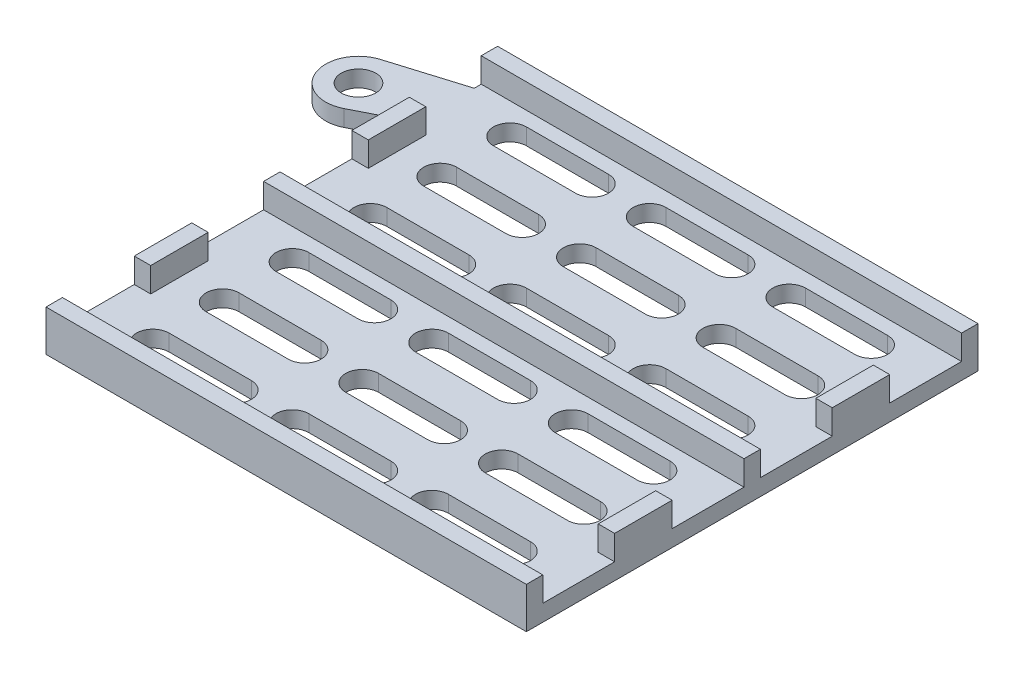
from build123d import *

# Parameters (mm, degrees)
SKETCH1_W           = 54.5
SKETCH1_H           = 24.5
BOSS_EXTRUDE1_DEPTH = 2
BOSS_EXTRUDE2_START = -2
SKETCH2_W           = 58.5
SKETCH2_H           = 28.5
SKETCH2_W_2         = 54.5
SKETCH2_H_2         = 24.5
BOSS_EXTRUDE2_DEPTH = 5
CUT_EXTRUDE1_DEPTH  = 33.918459867
FILL_PATTERN1_DEPTH = 2
LPATTERN1_COUNT     = 2
LPATTERN1_PITCH     = 8.5
LPATTERN1_COL_COUNT = 2
LPATTERN1_COL_PITCH = 8.5
SKETCH13_W          = 8.75
SKETCH13_H          = 3
CUT_EXTRUDE2_DEPTH  = 61.417816081
SKETCH34_R          = 2.1
BOSS_EXTRUDE4_DEPTH = 2


# Read off the part's stored shape, not the designer's step: Fill Pattern1
with BuildPart() as part:
    # Sketch1 → Boss-Extrude1 (new body)
    with BuildSketch(Plane(origin=(0, 0, 0), x_dir=(1, 0, 0), z_dir=(0, 1, 0))):
        Rectangle(SKETCH1_W, SKETCH1_H)
    extrude(amount=BOSS_EXTRUDE1_DEPTH)

    # Sketch2 → Boss-Extrude2 (add)
    with BuildSketch(Plane(origin=(0, 2, 0), x_dir=(1, 0, 0), z_dir=(0, 1, 0)).offset(BOSS_EXTRUDE2_START)):
        Rectangle(SKETCH2_W, SKETCH2_H)
        Rectangle(SKETCH2_W_2, SKETCH2_H_2, mode=Mode.SUBTRACT)
    extrude(amount=BOSS_EXTRUDE2_DEPTH)

    # Sketch5 → Cut-Extrude1 (cut, through all)
    with BuildSketch(Plane.XZ):
        with BuildLine():
            Line((-5, 2), (5, 2))
            ThreePointArc((5, 2), (7, 0), (5, -2))
            Line((5, -2), (-5, -2))
            ThreePointArc((-5, -2), (-7, 0), (-5, 2))
        make_face()
    cut_extrude1 = extrude(amount=-CUT_EXTRUDE1_DEPTH, mode=Mode.SUBTRACT)

    # Fill Pattern1 outline → Fill Pattern1 (cut)
    with BuildSketch(Plane(origin=(0, 0, 0), x_dir=(1, 0, 0), z_dir=(0, 1, 0))):
        with BuildLine():
            ThreePointArc((-22, 2), (-24, 0), (-22, -2))
            Line((-22, -2), (-12, -2))
            ThreePointArc((-12, -2), (-10, 0), (-12, 2))
            Line((-12, 2), (-22, 2))
        make_face()
        with BuildLine():
            ThreePointArc((12, 2), (10, 0), (12, -2))
            Line((12, -2), (22, -2))
            ThreePointArc((22, -2), (24, 0), (22, 2))
            Line((22, 2), (12, 2))
        make_face()
        with BuildLine():
            ThreePointArc((-22, 10.5), (-24, 8.5), (-22, 6.5))
            Line((-22, 6.5), (-12, 6.5))
            ThreePointArc((-12, 6.5), (-10, 8.5), (-12, 10.5))
            Line((-12, 10.5), (-22, 10.5))
        make_face()
        with BuildLine():
            ThreePointArc((12, 10.5), (10, 8.5), (12, 6.5))
            Line((12, 6.5), (22, 6.5))
            ThreePointArc((22, 6.5), (24, 8.5), (22, 10.5))
            Line((22, 10.5), (12, 10.5))
        make_face()
        with BuildLine():
            ThreePointArc((-22, -6.5), (-24, -8.5), (-22, -10.5))
            Line((-22, -10.5), (-12, -10.5))
            ThreePointArc((-12, -10.5), (-10, -8.5), (-12, -6.5))
            Line((-12, -6.5), (-22, -6.5))
        make_face()
        with BuildLine():
            ThreePointArc((12, -6.5), (10, -8.5), (12, -10.5))
            Line((12, -10.5), (22, -10.5))
            ThreePointArc((22, -10.5), (24, -8.5), (22, -6.5))
            Line((22, -6.5), (12, -6.5))
        make_face()
    extrude(amount=FILL_PATTERN1_DEPTH, mode=Mode.SUBTRACT)

    # LPattern1: Cut-Extrude1 ×2
    with Locations(*[(0, 0, i * LPATTERN1_PITCH) for i in range(1, LPATTERN1_COUNT)]):
        add(cut_extrude1, mode=Mode.SUBTRACT)

    # LPattern1 col: Cut-Extrude1 ×2
    with Locations(*[(0, 0, -i * LPATTERN1_COL_PITCH) for i in range(1, LPATTERN1_COL_COUNT)]):
        add(cut_extrude1, mode=Mode.SUBTRACT)

    # Sketch13 → Cut-Extrude2 (cut, through all)
    with BuildSketch(Plane(origin=(29.25, 0, 0), x_dir=(0, 0, -1), z_dir=(1, 0, 0))):
        with Locations((-7.875, 3.5)):
            Rectangle(SKETCH13_W, SKETCH13_H)
        with Locations((7.875, 3.5)):
            Rectangle(SKETCH13_W, SKETCH13_H)
    extrude(amount=-CUT_EXTRUDE2_DEPTH, mode=Mode.SUBTRACT)

    # Mirror1: part across plane


with BuildPart() as part_1:
    add(part.part)
    add(part.part.mirror(Plane.XY.offset(13.25)))

    # Sketch34 → Boss-Extrude4 (add)
    with BuildSketch(Plane(origin=(0, 2, 0), x_dir=(1, 0, 0), z_dir=(0, 1, 0))):
        with BuildLine():
            Line((-29.25, 11.400334068), (-38.010329233, 8.719922842))
            ThreePointArc((-38.010329233, 8.719922842), (-40.54977577, 3.399112638), (-35.029778513, 1.328016256))
            Line((-35.029778513, 1.328016256), (-30.75, 3.5))
            Line((-30.75, 3.5), (-29.25, 3.5))
            Line((-29.25, 3.5), (-29.25, 11.400334068))
        make_face()
        with Locations(Location((-36.84, 4.894961472, 0), (0, 0, 270))):
            Circle(SKETCH34_R, mode=Mode.SUBTRACT)
    extrude(amount=-BOSS_EXTRUDE4_DEPTH)


solid = part_1.part
